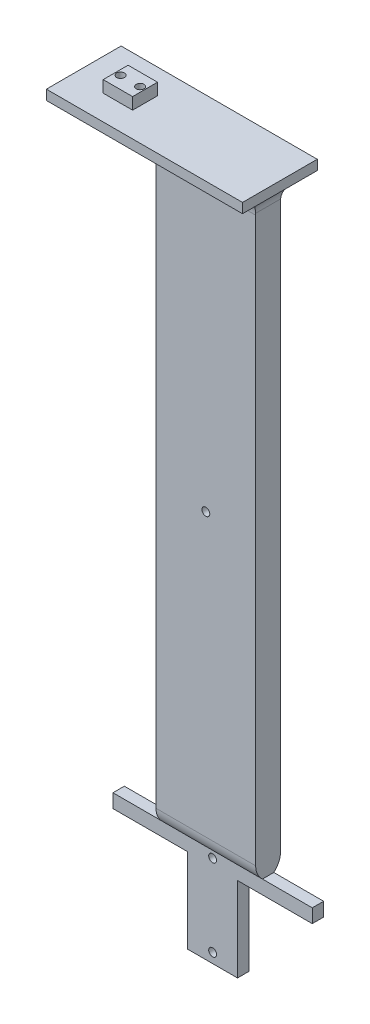
from build123d import *

# Parameters (mm, degrees)
BOSS_EXTRUDE1_DEPTH         = 5
BOSS_EXTRUDE2_DEPTH         = 6
TAP_DRILL_FOR_M4X0_7_TAP1_D = 3.3
SKETCH3_R                   = 2.000000000000003
CUT_EXTRUDE1_DEPTH          = 55.62510869554404
SKETCH12_R                  = 3.5
CUT_EXTRUDE2_DEPTH          = 3
BOSS_EXTRUDE3_DEPTH         = 304.8
SKETCH14_W                  = 101.6
SKETCH14_H                  = 5.799999999999999
BOSS_EXTRUDE4_DEPTH         = 7
FILLET1_R                   = 10
FILLET2_R                   = 10
FILLET3_R                   = 10
SKETCH15_R                  = 2.0000000000000036
CUT_EXTRUDE3_DEPTH          = 321.1833888570736
SKETCH16_W                  = 25.400000000000002
SKETCH16_H                  = 5.799999999999999
BOSS_EXTRUDE5_DEPTH         = 43.038
SKETCH17_R                  = 2.0000000000000036
CUT_EXTRUDE4_DEPTH          = 363.22668143581035
SKETCH18_R                  = 2.0000000000000036
CUT_EXTRUDE5_DEPTH          = 363.4521019996987


with BuildPart() as part:
    # Sketch1 → Boss-Extrude1 (new body)
    with BuildSketch(Plane(origin=(0, 0, 0), x_dir=(1, 0, 0), z_dir=(0, 1, 0))):
        Polygon((-49.99999999999999, 19.050000000000004), (50.00000000000001, 19.050000000000004), (50.000000000000014, -19.049999999999997), (-49.99999999999999, -19.049999999999997), align=None)
    extrude(amount=BOSS_EXTRUDE1_DEPTH)

    # Sketch2 → Boss-Extrude2 (add)
    with BuildSketch(Plane(origin=(0, 5, 0), x_dir=(1, 0, 0), z_dir=(0, 1, 0))):
        Polygon((-33.73664574389268, 6.349999999999993), (-18.736645743892684, 6.349999999999995), (-18.73664574389268, -6.350000000000003), (-33.73664574389268, -6.350000000000006), align=None)
    extrude(amount=BOSS_EXTRUDE2_DEPTH)

    # Tap Drill for M4x0.7 Tap1 (through all)
    with Locations(Plane(origin=(0, 11, 0), x_dir=(1, 0, 0), z_dir=(0, 1, 0))):
        with Locations((-31.236645744, 0), (-21.236645744, 0)):
            Hole(TAP_DRILL_FOR_M4X0_7_TAP1_D / 2)

    # Sketch3 → Cut-Extrude1 (cut, through all)
    with BuildSketch(Plane(origin=(0, 11, 0), x_dir=(1, 0, 0), z_dir=(0, 1, 0))):
        with Locations(Location((-21.236645743892684, 0, 0), (0, 0, 270))):
            Circle(SKETCH3_R)
        with Locations(Location((-31.23664574389268, 0, 0), (0, 0, 270))):
            Circle(SKETCH3_R)
    extrude(amount=-CUT_EXTRUDE1_DEPTH, mode=Mode.SUBTRACT)

    # Sketch12 → Cut-Extrude2 (cut)
    with BuildSketch(Plane.XZ):
        with Locations(Location((-31.23664574389268, 0, 0), (0, 0, 270))):
            Circle(SKETCH12_R)
        with Locations(Location((-21.236645743892684, 0, 0), (0, 0, 270))):
            Circle(SKETCH12_R)
    extrude(amount=-CUT_EXTRUDE2_DEPTH, mode=Mode.SUBTRACT)

    # Sketch13 → Boss-Extrude3 (add)
    with BuildSketch(Plane.XZ):
        Polygon((-6.799999999999993, 6.349999999999998), (44.00000000000001, 6.349999999999998), (44.00000000000001, -6.350000000000001), (-6.799999999999991, -6.350000000000001), align=None)
    extrude(amount=BOSS_EXTRUDE3_DEPTH)

    # Sketch14 → Boss-Extrude4 (add)
    with BuildSketch(Plane.XZ.offset(304.8)):
        with Locations((18.600000000000005, 2.89e-15)):
            Rectangle(SKETCH14_W, SKETCH14_H)
    extrude(amount=BOSS_EXTRUDE4_DEPTH)

    # Fillet1
    # the kernel refuses this fillet: 10 mm, written as the material it takes off along each edge
    with BuildSketch(Plane(origin=(62.89072192903172, -304.8, -6.350000000000001), x_dir=(0, 1, 0), z_dir=(-1, 0, 0))) as fillet1_piece_1:
        with BuildLine():
            CenterArc((7.556288771612685, -10), FILLET1_R, 90, 49.08035004511348)
            Line((0, -3.450000000000001), (-0.1511257754322628, -3.3190000000000013))
            ThreePointArc((-0.1511257754322628, -3.3190000000000013), (-0.19999999999998863, -1.7250000000000005), (-0.19999999999998863, 0))
            Line((-0.19999999999998863, 0), (0, 0.20000000000000018))
            Line((0, 0.20000000000000018), (7.556288771612685, 0.20000000000000018))
            Line((7.556288771612685, 0.20000000000000018), (7.556288771612685, 0))
        make_face()
    extrude(amount=88.58144385806342, mode=Mode.SUBTRACT)

    # Fillet2
    # the kernel refuses this fillet: 10 mm, written as the material it takes off along each edge
    with BuildSketch(Plane(origin=(-25.690721929031707, -304.8, 6.349999999999998), x_dir=(0, 1, 0), z_dir=(1, 0, 0))) as fillet2_piece_1:
        with BuildLine():
            CenterArc((7.556288771612685, -10), FILLET2_R, 90, 49.08035004511345)
            Line((0, -3.4499999999999957), (-0.1511257754322628, -3.3189999999999955))
            ThreePointArc((-0.1511257754322628, -3.3189999999999955), (-0.19999999999998863, -1.7249999999999979), (-0.19999999999998863, 0))
            Line((-0.19999999999998863, 0), (0, 0.20000000000000018))
            Line((0, 0.20000000000000018), (7.556288771612685, 0.20000000000000018))
            Line((7.556288771612685, 0.20000000000000018), (7.556288771612685, 0))
        make_face()
    extrude(amount=88.58144385806342, mode=Mode.SUBTRACT)

    # Fillet3
    # the kernel refuses this fillet: 10 mm, written as the material it adds along each edge
    with BuildSketch(Plane(origin=(44.00000000000001, 0, 6.349999999999998), x_dir=(1, 0, 0), z_dir=(0, 0, -1))) as fillet3_piece_1:
        with BuildLine():
            CenterArc((10, 9.165151389911683), FILLET3_R, 180, 66.42182152179822)
            Line((0, 9.165151389911683), (-0.20000000000000284, 9.165151389911683))
            Line((-0.20000000000000284, 9.165151389911683), (-0.20000000000000284, 0))
            Line((-0.20000000000000284, 0), (0, -0.2))
            ThreePointArc((0, -0.2), (3.000000000000007, -0.2), (5.920000000000009, -0.18330302779823368))
            Line((5.920000000000009, -0.18330302779823368), (6.000000000000007, 0))
        make_face()
    extrude(amount=12.7)
    with BuildSketch(Plane(origin=(-6.799999999999993, 0, 6.349999999999998), x_dir=(0, 0, 1), z_dir=(1, 0, 0))) as fillet3_piece_2:
        with BuildLine():
            CenterArc((FILLET3_R, FILLET3_R), FILLET3_R, 180, 90)
            Line((-3.55e-15, FILLET3_R), (-FILLET3_R * 0.02, FILLET3_R))
            Line((-FILLET3_R * 0.02, FILLET3_R), (-FILLET3_R * 0.02, -FILLET3_R * 0.02))
            Line((-FILLET3_R * 0.02, -FILLET3_R * 0.02), (FILLET3_R, -FILLET3_R * 0.02))
            Line((FILLET3_R, -FILLET3_R * 0.02), (FILLET3_R, 0))
        make_face()
    extrude(amount=50.8)
    with BuildSketch(Plane(origin=(-6.799999999999991, 0, -6.350000000000001), x_dir=(-1, 0, -1.4e-16), z_dir=(-1.4e-16, 0, 1))) as fillet3_piece_3:
        with BuildLine():
            CenterArc((FILLET3_R, FILLET3_R), FILLET3_R, 180, 90)
            Line((-8.9e-16, FILLET3_R), (-FILLET3_R * 0.02, FILLET3_R))
            Line((-FILLET3_R * 0.02, FILLET3_R), (-FILLET3_R * 0.02, -FILLET3_R * 0.02))
            Line((-FILLET3_R * 0.02, -FILLET3_R * 0.02), (FILLET3_R, -FILLET3_R * 0.02))
            Line((FILLET3_R, -FILLET3_R * 0.02), (FILLET3_R, 0))
        make_face()
    extrude(amount=12.7)
    with BuildSketch(Plane(origin=(44.00000000000001, 0, -6.350000000000001), x_dir=(0, 0, -1), z_dir=(-1, 0, 0))) as fillet3_piece_4:
        with BuildLine():
            CenterArc((FILLET3_R, FILLET3_R), FILLET3_R, 180, 90)
            Line((0, FILLET3_R), (-FILLET3_R * 0.02, FILLET3_R))
            Line((-FILLET3_R * 0.02, FILLET3_R), (-FILLET3_R * 0.02, -FILLET3_R * 0.02))
            Line((-FILLET3_R * 0.02, -FILLET3_R * 0.02), (FILLET3_R, -FILLET3_R * 0.02))
            Line((FILLET3_R, -FILLET3_R * 0.02), (FILLET3_R, 0))
        make_face()
    extrude(amount=50.8)
    with BuildSketch(Plane(origin=(44.00000000000001, 0, 29.262878474779207), x_dir=(1, 0, 0), z_dir=(0, 0, -1))) as fillet3_piece_5a_section:
        with BuildLine():
            CenterArc((10, 9.165151389911683), FILLET3_R, 180, 66.42182152179822)
            Line((0, 9.165151389911683), (-0.20000000000000284, 9.165151389911683))
            Line((-0.20000000000000284, 9.165151389911683), (-0.20000000000000284, 0))
            Line((-0.20000000000000284, 0), (0, -0.2))
            ThreePointArc((0, -0.2), (3.000000000000007, -0.2), (5.920000000000009, -0.18330302779823368))
            Line((5.920000000000009, -0.18330302779823368), (6.000000000000007, 0))
        make_face()
    fillet3_piece_5a = extrude(amount=35.61287847477921, mode=Mode.PRIVATE)
    fillet3_piece_5a = split(fillet3_piece_5a, bisect_by=Plane(origin=(45.551632877410285, -2.2318754420498643, 19.049999999999997), z_dir=(0, 0, -1)), keep=Keep.TOP, mode=Mode.PRIVATE)
    fillet3_piece_5a = split(fillet3_piece_5a, bisect_by=Plane(origin=(45.551632877410285, -2.2318754420498643, 6.349999999999998), z_dir=(0, 0, 1)), keep=Keep.TOP, mode=Mode.PRIVATE)
    with BuildSketch(Plane(origin=(-6.799999999999993, 0, 6.349999999999998), x_dir=(0, 0, 1), z_dir=(1, 0, 0))) as fillet3_piece_5b_section:
        with BuildLine():
            CenterArc((FILLET3_R, FILLET3_R), FILLET3_R, 180, 90)
            Line((-3.55e-15, FILLET3_R), (-FILLET3_R * 0.02, FILLET3_R))
            Line((-FILLET3_R * 0.02, FILLET3_R), (-FILLET3_R * 0.02, -FILLET3_R * 0.02))
            Line((-FILLET3_R * 0.02, -FILLET3_R * 0.02), (FILLET3_R, -FILLET3_R * 0.02))
            Line((FILLET3_R, -FILLET3_R * 0.02), (FILLET3_R, 0))
        make_face()
    fillet3_piece_5b = extrude(amount=75.8, mode=Mode.PRIVATE)
    fillet3_piece_5b = split(fillet3_piece_5b, bisect_by=Plane(origin=(50.000000000000014, -2.2639511426682537, 8.613951142668249), z_dir=(-1, 0, 1.9e-16)), keep=Keep.TOP, mode=Mode.PRIVATE)
    fillet3_piece_5b = split(fillet3_piece_5b, bisect_by=Plane(origin=(44.00000000000001, -2.2639511426682537, 8.613951142668249), z_dir=(1, 0, 0)), keep=Keep.TOP, mode=Mode.PRIVATE)
    fillet3_piece_5 = fillet3_piece_5a & fillet3_piece_5b
    add(fillet3_piece_5)
    with BuildSketch(Plane(origin=(69, 0, -6.350000000000001), x_dir=(0, 0, -1), z_dir=(-1, 0, 0))) as fillet3_piece_6a_section:
        with BuildLine():
            CenterArc((FILLET3_R, FILLET3_R), FILLET3_R, 180, 90)
            Line((0, FILLET3_R), (-FILLET3_R * 0.02, FILLET3_R))
            Line((-FILLET3_R * 0.02, FILLET3_R), (-FILLET3_R * 0.02, -FILLET3_R * 0.02))
            Line((-FILLET3_R * 0.02, -FILLET3_R * 0.02), (FILLET3_R, -FILLET3_R * 0.02))
            Line((FILLET3_R, -FILLET3_R * 0.02), (FILLET3_R, 0))
        make_face()
    fillet3_piece_6a = extrude(amount=75.79999999999998, mode=Mode.PRIVATE)
    fillet3_piece_6a = split(fillet3_piece_6a, bisect_by=Plane(origin=(50.00000000000001, -2.2639511426682555, -8.613951142668254), z_dir=(-1, 0, 1.9e-16)), keep=Keep.TOP, mode=Mode.PRIVATE)
    fillet3_piece_6a = split(fillet3_piece_6a, bisect_by=Plane(origin=(44.00000000000001, -2.2639511426682555, -8.613951142668252), z_dir=(1, 0, 0)), keep=Keep.TOP, mode=Mode.PRIVATE)
    with BuildSketch(Plane(origin=(44.00000000000001, 0, 6.349999999999998), x_dir=(1, 0, 0), z_dir=(0, 0, -1))) as fillet3_piece_6b_section:
        with BuildLine():
            CenterArc((10, 9.165151389911683), FILLET3_R, 180, 66.42182152179822)
            Line((0, 9.165151389911683), (-0.20000000000000284, 9.165151389911683))
            Line((-0.20000000000000284, 9.165151389911683), (-0.20000000000000284, 0))
            Line((-0.20000000000000284, 0), (0, -0.2))
            ThreePointArc((0, -0.2), (3.000000000000007, -0.2), (5.920000000000009, -0.18330302779823368))
            Line((5.920000000000009, -0.18330302779823368), (6.000000000000007, 0))
        make_face()
    fillet3_piece_6b = extrude(amount=35.61287847477921, mode=Mode.PRIVATE)
    fillet3_piece_6b = split(fillet3_piece_6b, bisect_by=Plane(origin=(45.55163287741028, -2.2318754420498657, -19.050000000000004), z_dir=(0, 0, 1)), keep=Keep.TOP, mode=Mode.PRIVATE)
    fillet3_piece_6b = split(fillet3_piece_6b, bisect_by=Plane(origin=(45.551632877410285, -2.2318754420498657, -6.350000000000001), z_dir=(0, 0, -1)), keep=Keep.TOP, mode=Mode.PRIVATE)
    fillet3_piece_6 = fillet3_piece_6a & fillet3_piece_6b
    add(fillet3_piece_6)
    with BuildSketch(Plane(origin=(-6.799999999999991, 0, -6.350000000000001), x_dir=(-1, 0, -1.4e-16), z_dir=(-1.4e-16, 0, 1))) as fillet3_piece_7a_section:
        with BuildLine():
            CenterArc((FILLET3_R, FILLET3_R), FILLET3_R, 180, 90)
            Line((-8.9e-16, FILLET3_R), (-FILLET3_R * 0.02, FILLET3_R))
            Line((-FILLET3_R * 0.02, FILLET3_R), (-FILLET3_R * 0.02, -FILLET3_R * 0.02))
            Line((-FILLET3_R * 0.02, -FILLET3_R * 0.02), (FILLET3_R, -FILLET3_R * 0.02))
            Line((FILLET3_R, -FILLET3_R * 0.02), (FILLET3_R, 0))
        make_face()
    fillet3_piece_7a = extrude(amount=37.699999999999996, mode=Mode.PRIVATE)
    fillet3_piece_7a = split(fillet3_piece_7a, bisect_by=Plane(origin=(-9.063951142668245, -2.2639511426682555, 19.049999999999997), z_dir=(0, 0, -1)), keep=Keep.TOP, mode=Mode.PRIVATE)
    fillet3_piece_7a = split(fillet3_piece_7a, bisect_by=Plane(origin=(-9.063951142668246, -2.2639511426682555, 6.349999999999998), z_dir=(0, 0, 1)), keep=Keep.TOP, mode=Mode.PRIVATE)
    with BuildSketch(Plane(origin=(-31.79999999999999, 0, 6.349999999999998), x_dir=(0, 0, 1), z_dir=(1, 0, 0))) as fillet3_piece_7b_section:
        with BuildLine():
            CenterArc((FILLET3_R, FILLET3_R), FILLET3_R, 180, 90)
            Line((-3.55e-15, FILLET3_R), (-FILLET3_R * 0.02, FILLET3_R))
            Line((-FILLET3_R * 0.02, FILLET3_R), (-FILLET3_R * 0.02, -FILLET3_R * 0.02))
            Line((-FILLET3_R * 0.02, -FILLET3_R * 0.02), (FILLET3_R, -FILLET3_R * 0.02))
            Line((FILLET3_R, -FILLET3_R * 0.02), (FILLET3_R, 0))
        make_face()
    fillet3_piece_7b = extrude(amount=75.8, mode=Mode.PRIVATE)
    fillet3_piece_7b = split(fillet3_piece_7b, bisect_by=Plane(origin=(-6.799999999999993, -2.263951142668253, 8.613951142668249), z_dir=(-1, 0, -1.4e-16)), keep=Keep.TOP, mode=Mode.PRIVATE)
    fillet3_piece_7 = fillet3_piece_7a & fillet3_piece_7b
    add(fillet3_piece_7)
    with BuildSketch(Plane(origin=(-6.799999999999987, 0, -31.349999999999998), x_dir=(-1, 0, -1.4e-16), z_dir=(-1.4e-16, 0, 1))) as fillet3_piece_8a_section:
        with BuildLine():
            CenterArc((FILLET3_R, FILLET3_R), FILLET3_R, 180, 90)
            Line((-8.9e-16, FILLET3_R), (-FILLET3_R * 0.02, FILLET3_R))
            Line((-FILLET3_R * 0.02, FILLET3_R), (-FILLET3_R * 0.02, -FILLET3_R * 0.02))
            Line((-FILLET3_R * 0.02, -FILLET3_R * 0.02), (FILLET3_R, -FILLET3_R * 0.02))
            Line((FILLET3_R, -FILLET3_R * 0.02), (FILLET3_R, 0))
        make_face()
    fillet3_piece_8a = extrude(amount=37.699999999999996, mode=Mode.PRIVATE)
    fillet3_piece_8a = split(fillet3_piece_8a, bisect_by=Plane(origin=(-9.063951142668245, -2.2639511426682524, -19.050000000000004), z_dir=(0, 0, 1)), keep=Keep.TOP, mode=Mode.PRIVATE)
    fillet3_piece_8a = split(fillet3_piece_8a, bisect_by=Plane(origin=(-9.063951142668245, -2.2639511426682524, -6.350000000000001), z_dir=(0, 0, -1)), keep=Keep.TOP, mode=Mode.PRIVATE)
    with BuildSketch(Plane(origin=(44.00000000000001, 0, -6.350000000000001), x_dir=(0, 0, -1), z_dir=(-1, 0, 0))) as fillet3_piece_8b_section:
        with BuildLine():
            CenterArc((FILLET3_R, FILLET3_R), FILLET3_R, 180, 90)
            Line((0, FILLET3_R), (-FILLET3_R * 0.02, FILLET3_R))
            Line((-FILLET3_R * 0.02, FILLET3_R), (-FILLET3_R * 0.02, -FILLET3_R * 0.02))
            Line((-FILLET3_R * 0.02, -FILLET3_R * 0.02), (FILLET3_R, -FILLET3_R * 0.02))
            Line((FILLET3_R, -FILLET3_R * 0.02), (FILLET3_R, 0))
        make_face()
    fillet3_piece_8b = extrude(amount=75.8, mode=Mode.PRIVATE)
    fillet3_piece_8b = split(fillet3_piece_8b, bisect_by=Plane(origin=(-6.799999999999991, -2.263951142668254, -8.613951142668252), z_dir=(-1, 0, -1.4e-16)), keep=Keep.TOP, mode=Mode.PRIVATE)
    fillet3_piece_8 = fillet3_piece_8a & fillet3_piece_8b
    add(fillet3_piece_8)

    # Sketch15 → Cut-Extrude3 (cut, through all)
    with BuildSketch(Plane(origin=(0, 0, -2.8999999999999972), x_dir=(-1, 0, 0), z_dir=(0, 0, -1))):
        with Locations((-18.60000000000002, -308.3)):
            Circle(SKETCH15_R)
    extrude(amount=-CUT_EXTRUDE3_DEPTH, mode=Mode.SUBTRACT)

    # Sketch16 → Boss-Extrude5 (add)
    with BuildSketch(Plane.XZ.offset(311.8)):
        with Locations((18.60000000000001, 2.89e-15)):
            Rectangle(SKETCH16_W, SKETCH16_H)
    extrude(amount=BOSS_EXTRUDE5_DEPTH)

    # Sketch17 → Cut-Extrude4 (cut, through all)
    with BuildSketch(Plane(origin=(0, 0, -2.8999999999999972), x_dir=(-1, 0, 0), z_dir=(0, 0, -1))):
        with Locations((-18.599999999999998, -349.838)):
            Circle(SKETCH17_R)
    extrude(amount=-CUT_EXTRUDE4_DEPTH, mode=Mode.SUBTRACT)

    # Sketch18 → Cut-Extrude5 (cut, through all)
    with BuildSketch(Plane.XY.offset(6.349999999999998)):
        with Locations((18.599999999999977, -153.62185561419372)):
            Circle(SKETCH18_R)
    extrude(amount=-CUT_EXTRUDE5_DEPTH, mode=Mode.SUBTRACT)


solid = part.part
